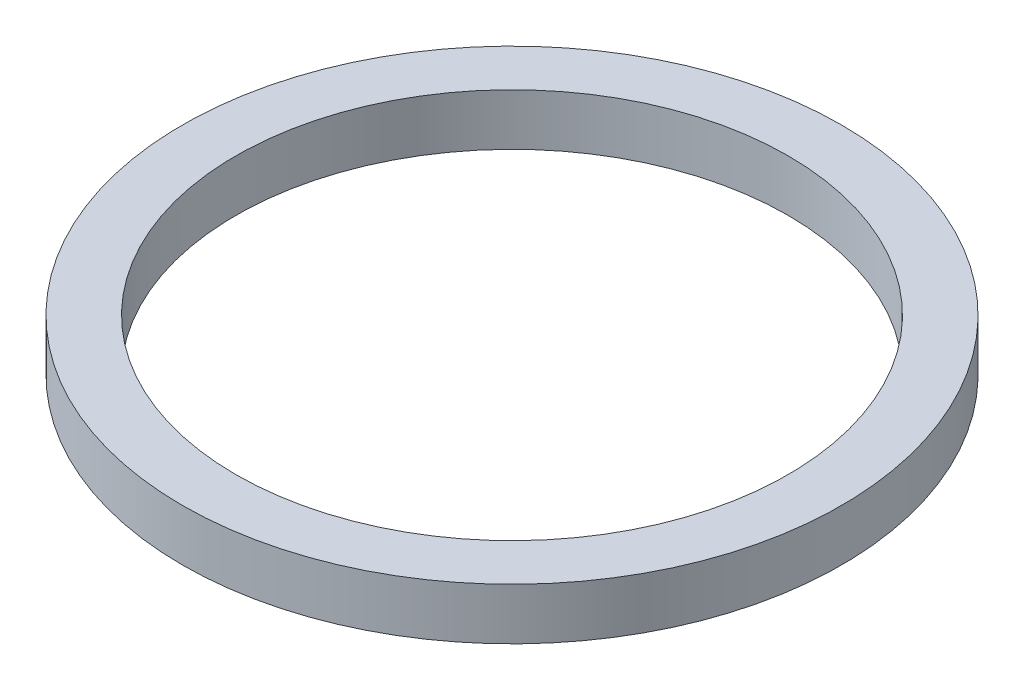
from build123d import *

# Parameters (mm, degrees)
SKETCH1_R           = 19.155
SKETCH1_R_2         = 16.05
BOSS_EXTRUDE1_DEPTH = 3


with BuildPart() as part:
    # Sketch1 → Boss-Extrude1 (new body)
    with BuildSketch(Plane(origin=(0, 0, 0), x_dir=(1, 0, 0), z_dir=(0, 1, 0))):
        Circle(SKETCH1_R)
        Circle(SKETCH1_R_2, mode=Mode.SUBTRACT)
    extrude(amount=BOSS_EXTRUDE1_DEPTH)


solid = part.part
